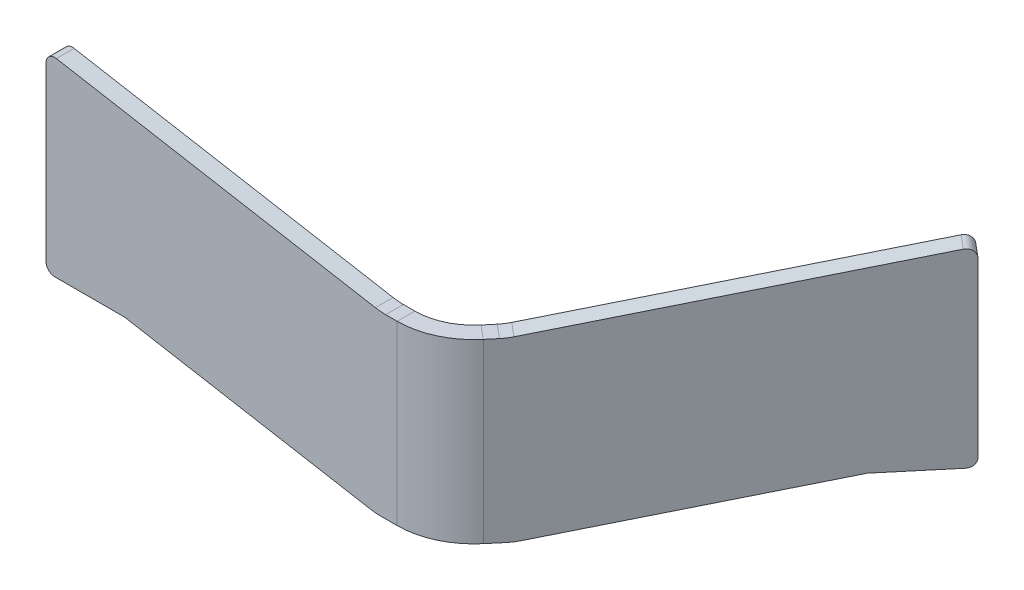
from build123d import *

# Parameters (mm, degrees)
BASE_EXTRUDE_DEPTH     = 6
PROCESS_BENDS1_START   = -47.212369611
PROCESS_BENDS1_DEPTH   = 79.424739222
PROCESS_BENDS1_START_2 = -29.212369611
PROCESS_BENDS1_2_DEPTH = 42
PROCESS_BENDS1_3_DEPTH = 79.379162481
PROCESS_BENDS1_START_3 = -7.599506721
PROCESS_BENDS1_4_DEPTH = 13.144247807
PROCESS_BENDS1_START_4 = -0.455258914
PROCESS_BENDS1_5_DEPTH = 6


with BuildPart() as part:
    # Sketch1 → Base-Extrude (new body)
    with BuildSketch(Plane.XY):
        with BuildLine():
            Line((-125.479055467, 32.16679287), (-17.29755389, 13.091475329))
            ThreePointArc((-17.29755389, 13.091475329), (-15.567705192, 12.863736427), (-13.824590337, 12.787630389))
            Line((-13.824590337, 12.787630389), (13.824590337, 12.787630389))
            ThreePointArc((13.824590337, 12.787630389), (15.567705192, 12.863736427), (17.29755389, 13.091475329))
            Line((17.29755389, 13.091475329), (125.479055467, 32.16679287))
            ThreePointArc((125.479055467, 32.16679287), (127.928362829, 31.51050294), (129, 29.212369611))
            Line((129, 29.212369611), (129, -29.212369611))
            ThreePointArc((129, -29.212369611), (128.121320344, -31.333689955), (126, -32.212369611))
            Line((126, -32.212369611), (102.366781185, -32.212369611))
            Line((102.366781185, -32.212369611), (19.020744173, -46.908524671))
            ThreePointArc((19.020744173, -46.908524671), (17.290895475, -47.136263573), (15.54778062, -47.212369611))
            Line((15.54778062, -47.212369611), (-15.54778062, -47.212369611))
            ThreePointArc((-15.54778062, -47.212369611), (-17.290895475, -47.136263573), (-19.020744173, -46.908524671))
            Line((-19.020744173, -46.908524671), (-102.366781185, -32.212369611))
            Line((-102.366781185, -32.212369611), (-126, -32.212369611))
            ThreePointArc((-126, -32.212369611), (-128.121320344, -31.333689955), (-129, -29.212369611))
            Line((-129, -29.212369611), (-129, 29.212369611))
            ThreePointArc((-129, 29.212369611), (-127.928362829, 31.51050294), (-125.479055467, 32.16679287))
        make_face()
    extrude(amount=BASE_EXTRUDE_DEPTH)

    # Process-Bends1: read off the stored shape, not the designer's step
    # Process-Bends1 outline → Process-Bends1 (cut)
    with BuildSketch(Plane(origin=(0, 0, 0), x_dir=(1, 0, 0), z_dir=(0, 1, 0)).offset(PROCESS_BENDS1_START)):
        with BuildLine():
            Line((129, 0), (6.692796258, 0))
            ThreePointArc((6.692796258, 0), (-1.088690602, -4.454038521), (-9.920451468, -6))
            Line((-9.920451468, -6), (129, -6))
            Line((129, -6), (129, 0))
        make_face()
    extrude(amount=PROCESS_BENDS1_DEPTH, mode=Mode.SUBTRACT)

    # Process-Bends1 2 outline → Process-Bends1 2 (add)
    with BuildSketch(Plane(origin=(0, 0, 0), x_dir=(1, 0, 0), z_dir=(0, 1, 0)).offset(PROCESS_BENDS1_START_2)):
        with BuildLine():
            ThreePointArc((6.692796258, 0), (8.418565431, 1.569577889), (9.996704053, 3.287522148))
            Line((9.996704053, 3.287522148), (86.539562416, 94.50774859))
            Line((86.539562416, 94.50774859), (81.943295757, 98.364474248))
            Line((81.943295757, 98.364474248), (5.400437394, 7.144247806))
            ThreePointArc((5.400437394, 7.144247806), (-1.468086233, 1.873844259), (-9.920451468, 0))
            Line((-9.920451468, 0), (6.692796258, 0))
        make_face()
    extrude(amount=PROCESS_BENDS1_2_DEPTH)

    # Process-Bends1 3 outline → Process-Bends1 3 (add)
    with BuildSketch(Plane(origin=(0, 0, 0), x_dir=(1, 0, 0), z_dir=(0, 1, 0)).offset(PROCESS_BENDS1_START)):
        with BuildLine():
            ThreePointArc((6.692796258, 0), (8.418565431, 1.569577889), (9.996704053, 3.287522148))
            Line((9.996704053, 3.287522148), (86.539562416, 94.50774859))
            Line((86.539562416, 94.50774859), (81.943295757, 98.364474248))
            Line((81.943295757, 98.364474248), (5.400437394, 7.144247806))
            ThreePointArc((5.400437394, 7.144247806), (-1.468086233, 1.873844259), (-9.920451468, 0))
            Line((-9.920451468, 0), (6.692796258, 0))
        make_face()
    extrude(amount=PROCESS_BENDS1_3_DEPTH)

    # Process-Bends1 4 outline → Process-Bends1 4 (cut)
    with BuildSketch(Plane(origin=(0, 0, 0), x_dir=(0.6427876096865379, 0, -0.7660444431189791), z_dir=(0.7660444431189791, 0, 0.6427876096865381)).offset(PROCESS_BENDS1_START_3)):
        with BuildLine():
            Line((-8, 12.787630389), (12.848284445, 12.787630389))
            ThreePointArc((12.848284445, 12.787630389), (14.5913993, 12.863736427), (16.321247998, 13.091475329))
            Line((16.321247998, 13.091475329), (124.502749575, 32.16679287))
            Line((124.502749575, 32.16679287), (-8, 32.16679287))
            Line((-8, 32.16679287), (-8, 12.787630389))
        make_face()
        with BuildLine():
            Line((128.023694108, 32.16679287), (125.54463864, 32.16679287))
            ThreePointArc((125.54463864, 32.16679287), (127.321827437, 31.14073244), (128.023694108, 29.212369611))
            Line((128.023694108, 29.212369611), (128.023694108, 32.16679287))
        make_face()
        with BuildLine():
            ThreePointArc((18.044438281, -46.908524671), (16.314589583, -47.136263573), (14.571474728, -47.212369611))
            Line((14.571474728, -47.212369611), (128.023694108, -47.212369611))
            Line((128.023694108, -47.212369611), (128.023694108, -29.212369611))
            ThreePointArc((128.023694108, -29.212369611), (127.145014451, -31.333689954), (125.023694108, -32.212369611))
            Line((125.023694108, -32.212369611), (101.390475292, -32.212369611))
            Line((101.390475292, -32.212369611), (18.044438281, -46.908524671))
        make_face()
    extrude(amount=PROCESS_BENDS1_4_DEPTH, mode=Mode.SUBTRACT)

    # Process-Bends1 5 outline → Process-Bends1 5 (add)
    with BuildSketch(Plane(origin=(0, 0, 0), x_dir=(0.6427876096865379, 0, -0.7660444431189791), z_dir=(0.7660444431189791, 0, 0.6427876096865381)).offset(PROCESS_BENDS1_START_4)):
        with BuildLine():
            ThreePointArc((125.54463864, 32.16679287), (125.023694107, 32.212369611), (124.502749575, 32.16679287))
            Line((124.502749575, 32.16679287), (125.54463864, 32.16679287))
        make_face()
    extrude(amount=PROCESS_BENDS1_5_DEPTH)


solid = part.part
